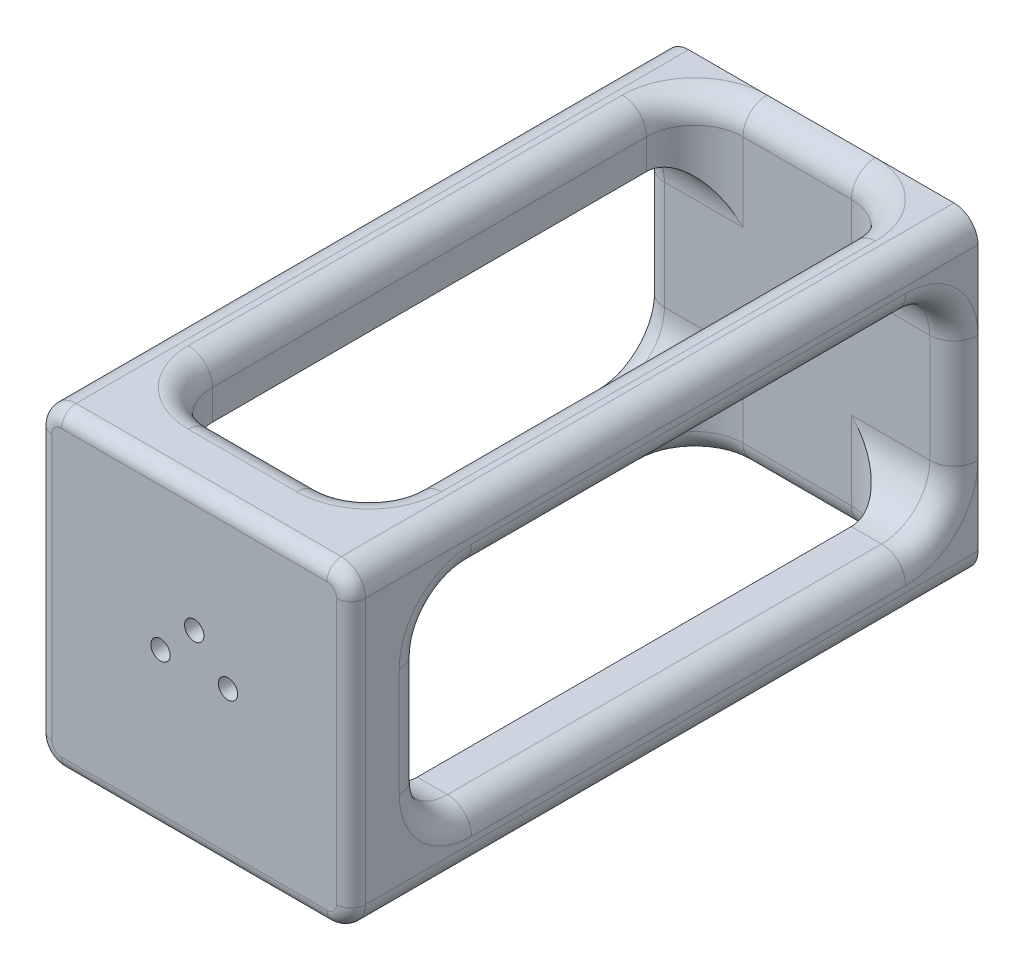
from build123d import *

# Parameters (mm, degrees)
SKETCH_1_W      = 65
SKETCH_1_H      = 65
SKETCH_1_R      = 2.15
EXTRUDE_1_DEPTH = 5
SKETCH_3_W      = 11.26
SKETCH_3_H      = 11.26
EXTRUDE_2_DEPTH = 120
SKETCH_4_W      = 65
SKETCH_4_H      = 65
SKETCH_4_R      = 2
EXTRUDE_3_DEPTH = 5
FILLET_1_R      = 10
FILLET_5_R      = 3
EXTRUDE_4_DEPTH = 10
FILLET_6_R      = 10
FILLET_8_R      = 5
FILLET_9_R      = 5
FILLET_10_R     = 5
FILLET_11_R     = 5
FILLET_12_R     = 5


# Some blends are built 0.0001 mm under size
with BuildPart() as part:
    # 草图1 → 凸台-拉伸1 (new body)
    with BuildSketch(Plane.XY):
        Rectangle(SKETCH_1_W, SKETCH_1_H)
        with Locations((-26.87, 26.87)):
            Circle(SKETCH_1_R, mode=Mode.SUBTRACT)
        with Locations(Location((26.87, 26.87, 0), (0, 0, 180))):
            Circle(SKETCH_1_R, mode=Mode.SUBTRACT)
        with Locations((26.87, -26.87)):
            Circle(SKETCH_1_R, mode=Mode.SUBTRACT)
        with Locations(Location((-26.87, -26.87, 0), (0, 0, 180))):
            Circle(SKETCH_1_R, mode=Mode.SUBTRACT)
    extrude(amount=EXTRUDE_1_DEPTH)

    # 草图3 → 凸台-拉伸2 (add)
    with BuildSketch(Plane.XY.offset(5)):
        with Locations((-26.87, 26.87)):
            Rectangle(SKETCH_3_W, SKETCH_3_H)
        with Locations((26.87, 26.87)):
            Rectangle(SKETCH_3_W, SKETCH_3_H)
        with Locations((26.87, -26.87)):
            Rectangle(SKETCH_3_W, SKETCH_3_H)
        with Locations((-26.87, -26.87)):
            Rectangle(SKETCH_3_W, SKETCH_3_H)
    extrude(amount=EXTRUDE_2_DEPTH)

    # 草图4 → 凸台-拉伸3 (add)
    with BuildSketch(Plane.XY.offset(125)):
        Rectangle(SKETCH_4_W, SKETCH_4_H)
        with Locations((0, 7)):
            Circle(SKETCH_4_R, mode=Mode.SUBTRACT)
        with Locations((7, 0)):
            Circle(SKETCH_4_R, mode=Mode.SUBTRACT)
        with Locations((-7, 0)):
            Circle(SKETCH_4_R, mode=Mode.SUBTRACT)
    extrude(amount=EXTRUDE_3_DEPTH)

    # 圆角1
    fillet_1_edges = [part.edges().sort_by_distance(p)[0] for p in [
        (-26.87, 21.24, 5),
        (-21.24, 26.87, 5),
        (21.24, 26.87, 5),
        (26.87, 21.24, 5),
        (21.24, -26.87, 5),
        (26.87, -21.24, 5),
        (-21.24, -26.87, 5),
        (-26.87, -21.24, 5),
    ]]
    fillet(fillet_1_edges, radius=FILLET_1_R)

    # 圆角5
    fillet_5_edges = [part.edges().sort_by_distance(p)[0] for p in [
        (-32.5, 0, 130),
        (0, -32.5, 130),
        (32.5, 0, 130),
        (0, 32.5, 130),
    ]]
    fillet(fillet_5_edges, radius=FILLET_5_R)

    # 草图6 → 凸台-拉伸4 (add)
    with BuildSketch(Plane(origin=(0, 0, 125), x_dir=(-1, 0, 0), z_dir=(0, 0, -1))):
        Polygon((32.5, 21.24), (21.24, 21.24), (21.24, 32.5), (-21.24, 32.5), (-21.24, 21.24), (-32.5, 21.24), (-32.5, -21.24), (-21.24, -21.24), (-21.24, -32.5), (21.24, -32.5), (21.24, -21.24), (32.5, -21.24), align=None)
    extrude(amount=EXTRUDE_4_DEPTH)

    # 圆角6
    fillet_6_edges = [part.edges().sort_by_distance(p)[0] for p in [
        (-26.87, 21.24, 115),
        (-21.24, 26.87, 115),
        (21.24, 26.87, 115),
        (26.87, 21.24, 115),
        (26.87, -21.24, 115),
        (21.24, -26.87, 115),
        (-21.24, -26.87, 115),
        (-26.87, -21.24, 115),
    ]]
    fillet(fillet_6_edges, radius=FILLET_6_R)

    # 圆角8
    fillet_8_edges = [part.edges().sort_by_distance(p)[0] for p in [
        (0, 32.5, 5),
        (-18.311067812, 32.5, 7.928932188),
        (18.311067812, 32.5, 7.928932188),
        (0, 32.5, 115),
        (-21.24, 32.5, 60),
        (21.24, 32.5, 60),
        (-18.311067812, 32.5, 112.071067812),
        (18.311067812, 32.5, 112.071067812),
    ]]
    fillet(fillet_8_edges, radius=FILLET_8_R - 0.0001)  # a hair under: the kernel refuses the full size

    # 圆角9
    fillet_9_edges = [part.edges().sort_by_distance(p)[0] for p in [
        (32.5, 0, 5),
        (32.5, 18.311067812, 7.928932188),
        (32.5, -18.311067812, 7.928932188),
        (32.5, 0, 115),
        (32.5, -21.24, 60),
        (32.5, 21.24, 60),
        (32.5, -18.311067812, 112.071067812),
        (32.5, 18.311067812, 112.071067812),
    ]]
    fillet(fillet_9_edges, radius=FILLET_9_R - 0.0001)  # a hair under: the kernel refuses the full size

    # 圆角10
    fillet_10_edges = [part.edges().sort_by_distance(p)[0] for p in [
        (0, -32.5, 5),
        (-18.311067812, -32.5, 7.928932188),
        (18.311067812, -32.5, 7.928932188),
        (0, -32.5, 115),
        (-21.24, -32.5, 60),
        (21.24, -32.5, 60),
        (-18.311067812, -32.5, 112.071067812),
        (18.311067812, -32.5, 112.071067812),
    ]]
    fillet(fillet_10_edges, radius=FILLET_10_R - 0.0001)  # a hair under: the kernel refuses the full size

    # 圆角11
    fillet_11_edges = [part.edges().sort_by_distance(p)[0] for p in [
        (-32.5, 0, 5),
        (-32.5, -18.311067812, 7.928932188),
        (-32.5, 18.311067812, 7.928932188),
        (-32.5, 0, 115),
        (-32.5, -21.24, 60),
        (-32.5, 21.24, 60),
        (-32.5, -18.311067812, 112.071067812),
        (-32.5, 18.311067812, 112.071067812),
    ]]
    fillet(fillet_11_edges, radius=FILLET_11_R - 0.0001)  # a hair under: the kernel refuses the full size

    # 圆角12
    # the kernel refuses this fillet: 5 mm, written as the material it takes off along each edge
    with BuildSketch(Plane(origin=(-27.5, -27.5, 130), x_dir=(-1, 0, 0), z_dir=(0, 1, 0))) as fillet_12_piece_1:
        with BuildLine():
            CenterArc((2, -3), 3, 0, 90)
            Line((5, -3), (5, 0))
            Line((5, 0), (2, 0))
        make_face()
    revolve(axis=Axis((-27.5, -27.5, 130), (0, 0, 1)), revolution_arc=90, mode=Mode.SUBTRACT)
    with BuildSketch(Plane(origin=(-27.5, 27.5, 130), x_dir=(0, 1, 0), z_dir=(1, 0, 0))) as fillet_12_piece_2:
        with BuildLine():
            CenterArc((2, -3), 3, 0, 90)
            Line((5, -3), (5, 0))
            Line((5, 0), (2, 0))
        make_face()
    revolve(axis=Axis((-27.5, 27.5, 130), (0, 0, 1)), revolution_arc=90, mode=Mode.SUBTRACT)
    with BuildSketch(Plane(origin=(27.5, -27.5, 130), x_dir=(0, -1, 0), z_dir=(-1, 0, 0))) as fillet_12_piece_3:
        with BuildLine():
            CenterArc((2, -3), 3, 0, 90)
            Line((5, -3), (5, 0))
            Line((5, 0), (2, 0))
        make_face()
    revolve(axis=Axis((27.5, -27.5, 130), (0, 0, 1)), revolution_arc=90, mode=Mode.SUBTRACT)
    with BuildSketch(Plane(origin=(27.5, 27.5, 130), x_dir=(1, 0, 0), z_dir=(0, -1, 0))) as fillet_12_piece_4:
        with BuildLine():
            CenterArc((2, -3), 3, 0, 90)
            Line((5, -3), (5, 0))
            Line((5, 0), (2, 0))
        make_face()
    revolve(axis=Axis((27.5, 27.5, 130), (0, 0, 1)), revolution_arc=90, mode=Mode.SUBTRACT)
    with BuildSketch(Plane(origin=(32.5, 32.5, 130), x_dir=(-1, 0, 0), z_dir=(0, 0, -1)), Plane(origin=(-32.5, -32.5, -12.5), x_dir=(0, 1, 0), z_dir=(0, 0, 1))) as fillet_12_piece_5:
        with BuildLine():
            CenterArc((FILLET_12_R, -FILLET_12_R), FILLET_12_R, 90, 90)
            Line((0, -FILLET_12_R), (0, 0))
            Line((0, 0), (FILLET_12_R, 0))
        make_face()
    extrude(amount=142.5, mode=Mode.SUBTRACT)
    with BuildSketch(Plane(origin=(32.5, -32.5, 130), x_dir=(-1, 0, 0), z_dir=(0, 0, -1)), Plane(origin=(-32.5, 32.5, -12.5), x_dir=(0, -1, 0), z_dir=(0, 0, 1))) as fillet_12_piece_6:
        with BuildLine():
            CenterArc((FILLET_12_R, FILLET_12_R), FILLET_12_R, 180, 90)
            Line((0, FILLET_12_R), (0, 0))
            Line((0, 0), (FILLET_12_R, 0))
        make_face()
    extrude(amount=142.5, mode=Mode.SUBTRACT)


solid = part.part
